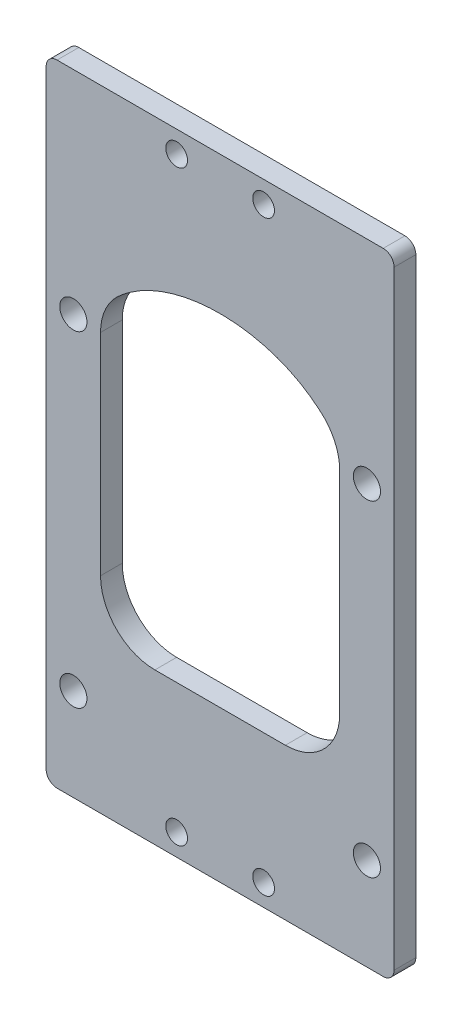
from build123d import *

# Parameters (mm, degrees)
EXTRUDE_1_OUTLINE_W  = 22
EXTRUDE_1_OUTLINE_H  = 29.37803775
EXTRUDE_1_DEPTH      = 2
FILLET_2_R           = 5
FILLET_3_R           = 5
FILLET_4_R           = 5
FILLET_5_DEPTH       = 2
FILLET_6_R           = 5
FILLET_7_R           = 5
SKETCH_4_R           = 1.25
CUT_EXTRUDE_1_DEPTH  = 2
SKETCH_5_R           = 1
CUT_EXTRUDE_3_DEPTH  = 10
CUT_EXTRUDE_4_DEPTH  = 10
EXTRUDE_3_DEPTH      = 2
SKETCH_8_R           = 1
CUT_EXTRUDE_5_DEPTH  = 2
SKETCH_9_W           = 4.328082866
SKETCH_9_H           = 16.646472559
EXTRUDE_5_DEPTH      = 2
SKETCH_11_R          = 1
CUT_EXTRUDE_6_DEPTH  = 2
SKETCH_14_W          = 35.331907889
SKETCH_14_H          = 71.069334822
CUT_EXTRUDE_7_DEPTH  = 10
SKETCH_15_W          = 33.93252641
SKETCH_15_H          = 4.378984323
EXTRUDE_6_DEPTH      = 2
SKETCH_16_W          = 33.760249026
SKETCH_16_H          = 7.770173485
CUT_EXTRUDE_9_DEPTH  = 2
CUT_EXTRUDE_10_DEPTH = 2
FILLET_8_R           = 5
EXTRUDE_START        = -2
EXTRUDE_7_DEPTH      = 2
EXTRUDE_8_DEPTH      = 2
SKETCH_20_W          = 32.150509504
SKETCH_20_H          = 6.514442596
CUT_EXTRUDE_11_DEPTH = 2
FILLET_9_R           = 5
SKETCH_23_R          = 1.25
CUT_EXTRUDE_12_DEPTH = 2
SKETCH_24_R          = 1.25
CUT_EXTRUDE_13_DEPTH = 10
CUT_EXTRUDE_14_DEPTH = 10
CUT_EXTRUDE_START    = -10
CUT_EXTRUDE_15_DEPTH = 10
SKETCH_28_R          = 1
EXTRUDE_10_DEPTH     = 2
SKETCH_29_W          = 32
SKETCH_29_H          = 4
SKETCH_29_R          = 1
EXTRUDE_11_DEPTH     = 2
SKETCH_31_R          = 1
CUT_EXTRUDE_17_DEPTH = 2
SKETCH_32_R          = 1
EXTRUDE_15_DEPTH     = 2
SKETCH_33_R          = 1
CUT_EXTRUDE_18_DEPTH = 2
SKETCH_35_R          = 1
EXTRUDE_16_DEPTH     = 2
SKETCH_36_W          = 32
SKETCH_36_H          = 2
EXTRUDE_17_DEPTH     = 2
SKETCH_37_R          = 1
EXTRUDE_19_DEPTH     = 2
SKETCH_38_R          = 1
CUT_EXTRUDE_21_DEPTH = 2
SKETCH_39_R          = 1
SKETCH_39_W          = 32
SKETCH_39_H          = 2
EXTRUDE_21_DEPTH     = 2
SKETCH_41_R          = 1
CUT_EXTRUDE_22_DEPTH = 2
FILLET_10_R          = 1


with BuildPart() as part:
    # 填料-伸長1: read off the stored shape, not the designer's step
    # 填料-伸長1 outline → 填料-伸長1 (new body)
    with BuildSketch(Plane.XY):
        with BuildLine():
            add(Edge.make_bspline(
                [(-32, 0), (-17.903811151, 0), (-12.226895644, -2.15390634), (-4.846905484, -2.579675003), (1.255778686, -1.586214789), (6.648848418, -2.437752115), (10.054997723, -2.228718788), (26.130584508, 3.269137633), (32.041733308, 41.295248118), (28.788818897, 71.787918144), (16.157681893, 46.951412799), (8.635768846, 50.925253654), (9.345383285, 39.571422639), (-5.414597035, 46), (-17.761888263, 46), (-32, 46)],
                knots=[0, 0, 0, 0, 0, 0, 0, 0, 0, 1, 1, 1, 1, 1, 1, 1, 1.916713019, 1.916713019, 1.916713019, 1.916713019, 1.916713019, 1.916713019, 1.916713019, 1.916713019, 1.916713019], degree=8))
            Line((-32, 46), (-37.468647548, 46))
            Line((-37.468647548, 46), (-37.468647548, 37.300656436))
            Line((-37.468647548, 37.300656436), (-32, 37.300656436))
            Line((-32, 37.300656436), (-32, 7.922618686))
            Line((-32, 7.922618686), (-37.468647548, 7.922618686))
            Line((-37.468647548, 7.922618686), (-37.468647548, 0))
            Line((-37.468647548, 0), (-32, 0))
        make_face()
        with Locations((-16, 22.611637561)):
            Rectangle(EXTRUDE_1_OUTLINE_W, EXTRUDE_1_OUTLINE_H, mode=Mode.SUBTRACT)
        Polygon((0, 37.300656436), (18.937237107, 37.300656436), (18.937237107, 17.573375048), (6.731868766, 7.922618686), (0, 7.922618686), align=None, mode=Mode.SUBTRACT)
    extrude(amount=EXTRUDE_1_DEPTH)

    # 圓角2
    fillet_2_edges = [part.edges().sort_by_distance(p)[0] for p in [
        (18.937237107, 37.300656436, 1),
    ]]
    fillet(fillet_2_edges, radius=FILLET_2_R)

    # 圓角3
    fillet_3_edges = [part.edges().sort_by_distance(p)[0] for p in [
        (18.937237107, 17.573375048, 1),
    ]]
    fillet(fillet_3_edges, radius=FILLET_3_R)

    # 圓角4
    fillet_4_edges = [part.edges().sort_by_distance(p)[0] for p in [
        (6.731868766, 7.922618686, 1),
    ]]
    fillet(fillet_4_edges, radius=FILLET_4_R)

    # 圓角5: read off the stored shape, not the designer's step
    # 圓角5 outline → 圓角5 (add)
    with BuildSketch(Plane.XY):
        with BuildLine():
            Line((0, 7.922618686), (4.993945193, 7.922618686))
            ThreePointArc((4.993945193, 7.922618686), (1.462326044, 9.38922246), (0, 12.92261502))
            Line((0, 12.92261502), (0, 7.922618686))
        make_face()
    extrude(amount=FILLET_5_DEPTH)

    # 圓角6
    fillet_6_edges = [part.edges().sort_by_distance(p)[0] for p in [
        (0, 37.300656436, 1),
        (-5, 7.922618686, 1),
        (-5, 37.300656436, 1),
        (-27, 37.300656436, 1),
        (-27, 7.922618686, 1),
    ]]
    fillet(fillet_6_edges, radius=FILLET_6_R)

    # 圓角7
    fillet_7_edges = [part.edges().sort_by_distance(p)[0] for p in [
        (-32, 7.922618686, 1),
        (-32, 37.300656436, 1),
    ]]
    fillet(fillet_7_edges, radius=FILLET_7_R)

    # 草圖4 → 除料-伸長1 (cut)
    with BuildSketch(Plane.XY.offset(2)):
        with Locations((-2.5, 32.5)):
            Circle(SKETCH_4_R)
        with Locations((-2.5, 2.5)):
            Circle(SKETCH_4_R)
        with Locations((-29.5, 2.5)):
            Circle(SKETCH_4_R)
        with Locations((-29.5, 32.5)):
            Circle(SKETCH_4_R)
    extrude(amount=-CUT_EXTRUDE_1_DEPTH, mode=Mode.SUBTRACT)

    # 草圖5 → 除料-伸長3 (cut)
    with BuildSketch(Plane.XY.offset(2)):
        with Locations((15.768736936, 44.547982454)):
            Circle(SKETCH_5_R)
        with Locations((21.425591185, 38.891128205)):
            Circle(SKETCH_5_R)
        with Locations((18.503337652, 13.912131705)):
            Circle(SKETCH_5_R)
        with Locations((12.846483402, 8.255277455)):
            Circle(SKETCH_5_R)
    extrude(amount=-CUT_EXTRUDE_3_DEPTH, mode=Mode.SUBTRACT)

    # 草圖6 → 除料-伸長4 (cut)
    with BuildSketch(Plane.XY.offset(2)):
        with BuildLine():
            Line((-25.535533906, 35.836190342), (-6.464466094, 35.836190342))
            add(Edge.make_bspline(
                [(-25.535533906, 35.836190342), (-21.735533906, 39.414802563), (-16, 40.309589175), (-10.264466094, 39.414802563), (-6.464466094, 35.836190342)],
                knots=[0, 0, 0, 0, 0, 1, 1, 1, 1, 1], degree=4))
        make_face()
    extrude(amount=-CUT_EXTRUDE_4_DEPTH, mode=Mode.SUBTRACT)

    # 草圖7 → 填料-伸長3 (add)
    with BuildSketch(Plane.XY.offset(2)):
        with BuildLine():
            Line((-32.468647548, 37.300656436), (-38.802161961, 37.300656436))
            ThreePointArc((-38.802161961, 37.300656436), (-42.337695867, 35.836190342), (-43.802161961, 32.300656436))
            Line((-43.802161961, 32.300656436), (-43.802161961, 12.922618686))
            ThreePointArc((-43.802161961, 12.922618686), (-42.337695867, 9.38708478), (-38.802161961, 7.922618686))
            Line((-38.802161961, 7.922618686), (-32.468647548, 7.922618686))
            Line((-32.468647548, 7.922618686), (-32.468647548, 0))
            Line((-32.468647548, 0), (-38.802161961, 0))
            Line((-38.802161961, 0), (-43.802161961, 0))
            Line((-43.802161961, 0), (-49.941860706, 0))
            Line((-49.941860706, 0), (-49.941860706, 46))
            Line((-49.941860706, 46), (-45.941860706, 46))
            Line((-45.941860706, 46), (-38.802161961, 46))
            Line((-38.802161961, 46), (-32.468647548, 46))
            Line((-32.468647548, 46), (-32.468647548, 37.300656436))
        make_face()
    extrude(amount=-EXTRUDE_3_DEPTH)

    # 草圖8 → 除料-伸長5 (cut)
    with BuildSketch(Plane.XY.offset(2)):
        with Locations((-46.872011333, 27)):
            Circle(SKETCH_8_R)
        with Locations((-46.872011333, 19)):
            Circle(SKETCH_8_R)
    extrude(amount=-CUT_EXTRUDE_5_DEPTH, mode=Mode.SUBTRACT)

    # 草圖9 → 填料-伸長5 (add)
    with BuildSketch(Plane.XY.offset(2)):
        with Locations((-46.861716305, 22.916170807)):
            Rectangle(SKETCH_9_W, SKETCH_9_H)
    extrude(amount=-EXTRUDE_5_DEPTH)

    # 草圖11 → 除料-伸長6 (cut)
    with BuildSketch(Plane.XY.offset(2)):
        with Locations((-47.941860706, 27)):
            Circle(SKETCH_11_R)
        with Locations((-47.941860706, 19)):
            Circle(SKETCH_11_R)
    extrude(amount=-CUT_EXTRUDE_6_DEPTH, mode=Mode.SUBTRACT)

    # 草圖14 → 除料-伸長7 (cut)
    with BuildSketch(Plane(origin=(0, 0, 0), x_dir=(-1, 0, 0), z_dir=(0, 0, -1))):
        with Locations((-17.665953945, 27.656712391)):
            Rectangle(SKETCH_14_W, SKETCH_14_H)
    extrude(amount=-CUT_EXTRUDE_7_DEPTH, mode=Mode.SUBTRACT)

    # 草圖15 → 填料-伸長6 (add)
    with BuildSketch(Plane(origin=(0, 0, 0), x_dir=(-1, 0, 0), z_dir=(0, 0, -1))):
        with Locations((16.966263205, 43.810507839)):
            Rectangle(SKETCH_15_W, SKETCH_15_H)
    extrude(amount=-EXTRUDE_6_DEPTH)

    # 草圖16 → 除料-伸長9 (cut)
    with BuildSketch(Plane(origin=(0, 0, 0), x_dir=(-1, 0, 0), z_dir=(0, 0, -1))):
        with Locations((16.880124513, -3.885086743)):
            Rectangle(SKETCH_16_W, SKETCH_16_H)
    extrude(amount=-CUT_EXTRUDE_9_DEPTH, mode=Mode.SUBTRACT)

    # 草圖17 → 除料-伸長10 (cut)
    with BuildSketch(Plane.XY.offset(2)):
        with BuildLine():
            Line((-5.416994756, 46), (0, 46))
            Line((0, 46), (0, 34))
            ThreePointArc((0, 34), (-1.416994756, 40.583005244), (-5.416994756, 46))
        make_face()
    extrude(amount=-CUT_EXTRUDE_10_DEPTH, mode=Mode.SUBTRACT)

    # 圓角8
    fillet_8_edges = [part.edges().sort_by_distance(p)[0] for p in [
        (-49.941860706, 46, 1),
        (-49.941860706, 0, 1),
    ]]
    fillet(fillet_8_edges, radius=FILLET_8_R)

    # 填料-伸長7: read off the stored shape, not the designer's step
    # 填料-伸長7 outline → 填料-伸長7 (add)
    with BuildSketch(Plane.XY.offset(2).offset(EXTRUDE_START)):
        with BuildLine():
            ThreePointArc((-49.941860706, -4.227169739), (-48.36025598, -7.876063738), (-44.616051215, -9.216523212))
            add(Edge.make_bspline(
                [(-44.616051215, -9.216523212), (-33.742886609, -9.216523212), (-25.346473604, -9.216523212), (-23.751624206, -9.216523212), (-22.145120862, -8.325283843), (-15.674190509, 0)],
                knots=[0, 0, 0, 0, 0, 0, 1, 1, 1, 1, 1, 1], degree=5))
            Line((-15.674190509, 0), (-44.941860706, 0))
            ThreePointArc((-44.941860706, 0), (-48.477394612, 1.464466094), (-49.941860706, 5))
            Line((-49.941860706, 5), (-49.941860706, -4.227169739))
        make_face()
    extrude(amount=EXTRUDE_7_DEPTH)

    # 填料-伸長8: read off the stored shape, not the designer's step
    # 填料-伸長8 outline → 填料-伸長8 (add)
    with BuildSketch(Plane.XY.offset(2).offset(EXTRUDE_START)):
        with BuildLine():
            Line((-44.941860706, 46), (-5.416994756, 46))
            add(Edge.make_bspline(
                [(-5.416994756, 46), (-5.995214333, 46.509941735), (-8.96505883, 47.689704563), (-13.043339364, 49.589177689), (-19.132826738, 50.371313682), (-34.255378163, 50.371313682), (-40.342930342, 50.371313682)],
                knots=[0, 0, 0, 0, 0, 0, 0, 1, 1, 1, 1, 1, 1, 1], degree=6))
            Line((-40.342930342, 50.371313682), (-44.941860706, 50.371313682))
            ThreePointArc((-44.941860706, 50.371313682), (-48.477394612, 48.906847588), (-49.941860706, 45.371313682))
            Line((-49.941860706, 45.371313682), (-49.941860706, 41))
            ThreePointArc((-49.941860706, 41), (-48.477394612, 44.535533906), (-44.941860706, 46))
        make_face()
    extrude(amount=EXTRUDE_8_DEPTH)

    # 草圖20 → 除料-伸長11 (cut)
    with BuildSketch(Plane.XY.offset(2)):
        with Locations((-33.866605954, -7.484391037)):
            Rectangle(SKETCH_20_W, SKETCH_20_H)
    extrude(amount=-CUT_EXTRUDE_11_DEPTH, mode=Mode.SUBTRACT)

    # 圓角9
    fillet_9_edges = [part.edges().sort_by_distance(p)[0] for p in [
        (-49.941860706, -4.227169739, 1),
        (-19.111361456, -4.227169739, 1),
        (-15.674190509, 0, 1),
    ]]
    fillet(fillet_9_edges, radius=FILLET_9_R)

    # 草圖23 → 除料-伸長12 (cut)
    with BuildSketch(Plane(origin=(0, 0, 0), x_dir=(-1, 0, 0), z_dir=(0, 0, -1))):
        with Locations((46.883721416, 2.5)):
            Circle(SKETCH_23_R)
    extrude(amount=-CUT_EXTRUDE_12_DEPTH, mode=Mode.SUBTRACT)

    # 草圖24 → 除料-伸長13 (cut)
    with BuildSketch(Plane(origin=(0, 0, 0), x_dir=(-1, 0, 0), z_dir=(0, 0, -1))):
        with Locations((46.883721416, 40.144143942)):
            Circle(SKETCH_24_R)
        with Locations((36.499999996, 40.144143942)):
            Circle(SKETCH_24_R)
    extrude(amount=-CUT_EXTRUDE_13_DEPTH, mode=Mode.SUBTRACT)

    # 草圖25 → 除料-伸長14 (cut)
    with BuildSketch(Plane(origin=(0, 0, 0), x_dir=(-1, 0, 0), z_dir=(0, 0, -1))):
        Polygon((5.416994756, 46), (32, 46), (32, 32.300656436), (32, 0), (0, 0), (0, -4.227169739), (49.941860706, -4.227169739), (49.941860706, 50.371313682), (5.416994756, 50.371313682), align=None)
    extrude(amount=-CUT_EXTRUDE_14_DEPTH, mode=Mode.SUBTRACT)

    # 草圖26 → 除料-伸長15 (cut)
    with BuildSketch(Plane(origin=(0, 0, 0), x_dir=(-1, 0, 0), z_dir=(0, 0, -1)).offset(CUT_EXTRUDE_START)):
        with BuildLine():
            Line((26.583005244, 46), (32, 46))
            Line((32, 46), (32, 34))
            ThreePointArc((32, 34), (30.583005244, 40.583005244), (26.583005244, 46))
        make_face()
    extrude(amount=CUT_EXTRUDE_15_DEPTH, mode=Mode.SUBTRACT)

    # 草圖28 → 填料-伸長10 (add)
    with BuildSketch(Plane(origin=(0, 0, 0), x_dir=(-1, 0, 0), z_dir=(0, 0, -1)).offset(EXTRUDE_START)):
        with BuildLine():
            Line((0, 34), (0, 50))
            Line((0, 50), (32, 50))
            Line((32, 50), (32, 34))
            ThreePointArc((32, 34), (30.583005244, 40.583005244), (26.583005244, 46))
            Line((26.583005244, 46), (5.416994756, 46))
            ThreePointArc((5.416994756, 46), (1.416994756, 40.583005244), (0, 34))
        make_face()
        with Locations((16, 48)):
            Circle(SKETCH_28_R, mode=Mode.SUBTRACT)
    extrude(amount=EXTRUDE_10_DEPTH)

    # 草圖29 → 填料-伸長11 (add)
    with BuildSketch(Plane(origin=(0, 0, 0), x_dir=(-1, 0, 0), z_dir=(0, 0, -1))):
        with Locations((16, -2)):
            Rectangle(SKETCH_29_W, SKETCH_29_H)
        with Locations((16, -2)):
            Circle(SKETCH_29_R, mode=Mode.SUBTRACT)
    extrude(amount=-EXTRUDE_11_DEPTH)

    # 草圖31 → 除料-伸長17 (cut)
    with BuildSketch(Plane(origin=(0, 0, 0), x_dir=(-1, 0, 0), z_dir=(0, 0, -1))):
        with Locations((12, 48)):
            Circle(SKETCH_31_R)
        with Locations((20, 48)):
            Circle(SKETCH_31_R)
    extrude(amount=-CUT_EXTRUDE_17_DEPTH, mode=Mode.SUBTRACT)

    # 草圖32 → 填料-伸長15 (add)
    with BuildSketch(Plane(origin=(0, 0, 0), x_dir=(-1, 0, 0), z_dir=(0, 0, -1)).offset(EXTRUDE_START)):
        with Locations((16, 48)):
            Circle(SKETCH_32_R)
    extrude(amount=EXTRUDE_15_DEPTH)

    # 草圖33 → 除料-伸長18 (cut)
    with BuildSketch(Plane(origin=(0, 0, 0), x_dir=(-1, 0, 0), z_dir=(0, 0, -1))):
        with Locations((12, -2)):
            Circle(SKETCH_33_R)
        with Locations((20, -2)):
            Circle(SKETCH_33_R)
    extrude(amount=-CUT_EXTRUDE_18_DEPTH, mode=Mode.SUBTRACT)

    # 草圖35 → 填料-伸長16 (add)
    with BuildSketch(Plane(origin=(0, 0, 0), x_dir=(-1, 0, 0), z_dir=(0, 0, -1))):
        with Locations((16, -2)):
            Circle(SKETCH_35_R)
    extrude(amount=-EXTRUDE_16_DEPTH)

    # 草圖36 → 填料-伸長17 (add)
    with BuildSketch(Plane(origin=(0, 0, 0), x_dir=(-1, 0, 0), z_dir=(0, 0, -1))):
        with Locations((16, 51)):
            Rectangle(SKETCH_36_W, SKETCH_36_H)
    extrude(amount=-EXTRUDE_17_DEPTH)

    # 草圖37 → 填料-伸長19 (add)
    with BuildSketch(Plane(origin=(0, 0, 0), x_dir=(-1, 0, 0), z_dir=(0, 0, -1))):
        with Locations((12, 48)):
            Circle(SKETCH_37_R)
        with Locations((20, 48)):
            Circle(SKETCH_37_R)
    extrude(amount=-EXTRUDE_19_DEPTH)

    # 草圖38 → 除料-伸長21 (cut)
    with BuildSketch(Plane(origin=(0, 0, 0), x_dir=(-1, 0, 0), z_dir=(0, 0, -1))):
        with Locations((12, 50)):
            Circle(SKETCH_38_R)
        with Locations((20, 50)):
            Circle(SKETCH_38_R)
    extrude(amount=-CUT_EXTRUDE_21_DEPTH, mode=Mode.SUBTRACT)

    # 草圖39 → 填料-伸長21 (add)
    with BuildSketch(Plane.XY.offset(2).offset(EXTRUDE_START)):
        with Locations((-20, -2)):
            Circle(SKETCH_39_R)
        with Locations((-12, -2)):
            Circle(SKETCH_39_R)
        with Locations((-16, -5)):
            Rectangle(SKETCH_39_W, SKETCH_39_H)
    extrude(amount=EXTRUDE_21_DEPTH)

    # 草圖41 → 除料-伸長22 (cut)
    with BuildSketch(Plane.XY.offset(2)):
        with Locations((-20, -4)):
            Circle(SKETCH_41_R)
        with Locations((-12, -4)):
            Circle(SKETCH_41_R)
    extrude(amount=-CUT_EXTRUDE_22_DEPTH, mode=Mode.SUBTRACT)

    # 圓角10
    fillet_10_edges = [part.edges().sort_by_distance(p)[0] for p in [
        (0, 52, 1),
        (-32, 52, 1),
        (-32, -6, 1),
        (0, -6, 1),
    ]]
    fillet(fillet_10_edges, radius=FILLET_10_R)


solid = part.part
